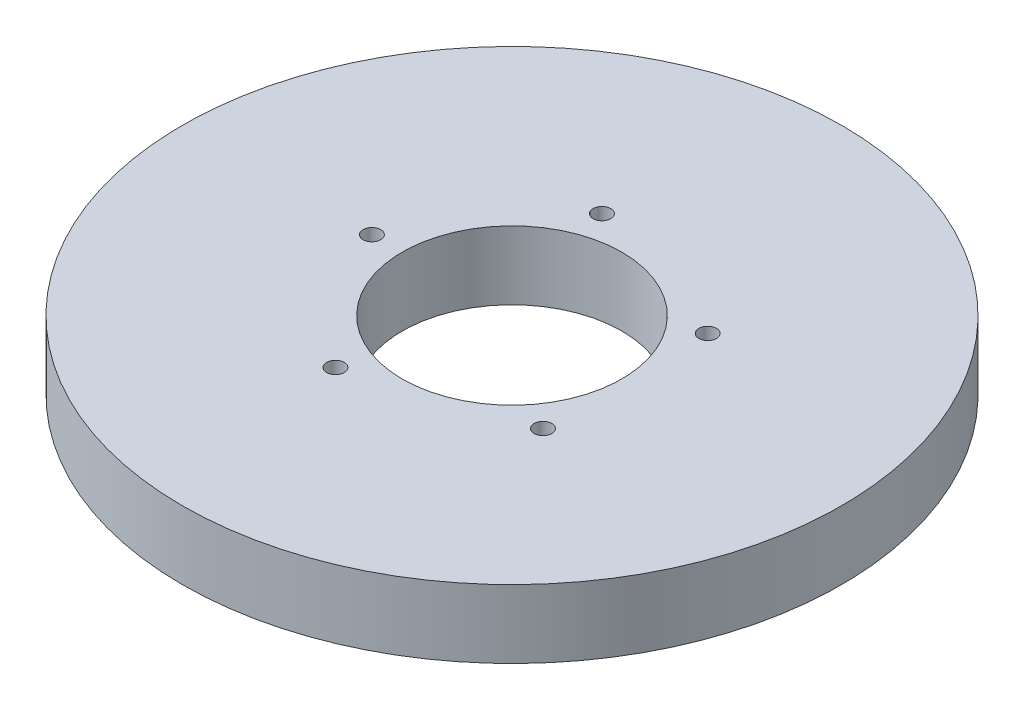
from build123d import *

# Parameters (mm, degrees)
SKETCH1_R           = 67.5
BOSS_EXTRUDE1_DEPTH = 14
SKETCH2_R           = 22.5
CUT_EXTRUDE1_DEPTH  = 97.480567992
SKETCH3_R           = 1.800703546
CUT_EXTRUDE2_DEPTH  = 12.596583738
CIRPATTERN1_COUNT   = 5


with BuildPart() as part:
    # Sketch1 → Boss-Extrude1 (new body)
    with BuildSketch(Plane(origin=(0, 0, 0), x_dir=(1, 0, 0), z_dir=(0, 1, 0))):
        Circle(SKETCH1_R)
    extrude(amount=BOSS_EXTRUDE1_DEPTH)

    # Sketch2 → Cut-Extrude1 (cut, through all)
    with BuildSketch(Plane(origin=(0, 0, 0), x_dir=(1, 0, 0), z_dir=(0, 1, 0))):
        Circle(SKETCH2_R)
    extrude(amount=CUT_EXTRUDE1_DEPTH, mode=Mode.SUBTRACT)

    # Sketch3 → Cut-Extrude2 (cut)
    with BuildSketch(Plane(origin=(0, 14, 0), x_dir=(1, 0, 0), z_dir=(0, 1, 0))):
        with Locations((-28.692598479, 0)):
            Circle(SKETCH3_R)
    cut_extrude2 = extrude(amount=-CUT_EXTRUDE2_DEPTH, mode=Mode.SUBTRACT)

    # CirPattern1: Cut-Extrude2 ×5 about axis
    cirpattern1_axis = Axis((0, 0, 0), (0, 1, 0))
    for i in range(1, CIRPATTERN1_COUNT):
        add(cut_extrude2.rotate(cirpattern1_axis, i * 360 / CIRPATTERN1_COUNT), mode=Mode.SUBTRACT)


solid = part.part
